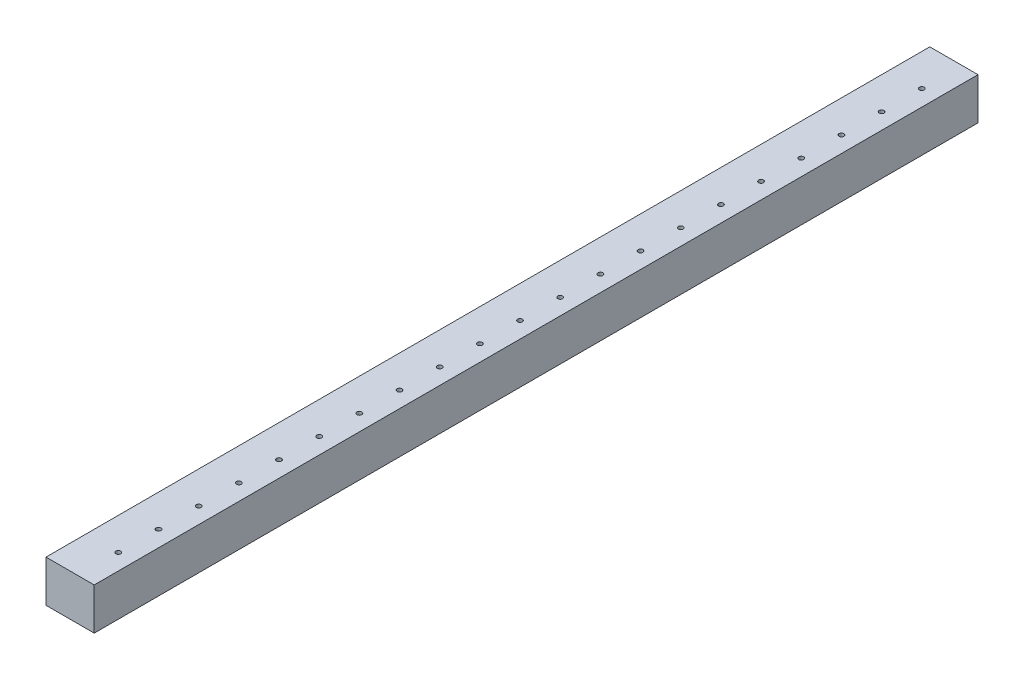
from build123d import *

# Parameters (mm, degrees)
ESQUISSE1_W                     = 30
ESQUISSE1_H                     = 36
BOSS_EXTRU_1_DEPTH              = 550
ENL_V_MAT_EXTRU_1_DEPTH         = 551.498864667
ENL_V_MAT_EXTRU_1_DEPTH_BACK    = 551.498864667
ESQUISSE2_W                     = 20
ESQUISSE2_H                     = 10
ESQUISSE3_R                     = 1.5
ENL_V_MAT_EXTRU_2_DEPTH         = 20
R_P_TITION_LIN_AIRE1_COUNT      = 11
R_P_TITION_LIN_AIRE1_PITCH      = 25
R_P_TITION_LIN_AIRE1_COUNT_DIR2 = 11
R_P_TITION_LIN_AIRE1_PITCH_DIR2 = 25
ENL_V_MAT_EXTRU_3_DEPTH         = 551.498864667
ENL_V_MAT_EXTRU_3_DEPTH_BACK    = 551.498864667
ESQUISSE4_W                     = 10
ESQUISSE4_H                     = 10


with BuildPart() as part:
    # Esquisse1 → Boss.-Extru.1 (new body)
    with BuildSketch(Plane.XY):
        Rectangle(ESQUISSE1_W, ESQUISSE1_H)
    extrude(amount=BOSS_EXTRU_1_DEPTH)

    # Esquisse2 → Enlèv. mat.-Extru.1 (cut, two sides: drawn at the far end of the back side and taken through both)
    with BuildSketch(Plane.XY.offset(550).offset(-ENL_V_MAT_EXTRU_1_DEPTH_BACK)):
        with Locations((5, 13)):
            Rectangle(ESQUISSE2_W, ESQUISSE2_H)
    extrude(amount=ENL_V_MAT_EXTRU_1_DEPTH + ENL_V_MAT_EXTRU_1_DEPTH_BACK, mode=Mode.SUBTRACT)

    # Esquisse3 → Enlèv. mat.-Extru.2 (cut)
    with BuildSketch(Plane(origin=(0, 8, 0), x_dir=(1, 0, 0), z_dir=(0, 1, 0))):
        with Locations((5, -275)):
            Circle(ESQUISSE3_R)
    enl_v_mat_extru_2 = extrude(amount=-ENL_V_MAT_EXTRU_2_DEPTH, mode=Mode.SUBTRACT)

    # Répétition linéaire1: Enl_v. mat.-Extru.2 11 × 11
    with Locations(*[Vector(0, 0, -1) * (i * R_P_TITION_LIN_AIRE1_PITCH) + Vector(0, 0, 1) * (j * R_P_TITION_LIN_AIRE1_PITCH_DIR2) for i in range(R_P_TITION_LIN_AIRE1_COUNT) for j in range(R_P_TITION_LIN_AIRE1_COUNT_DIR2) if (i, j) != (0, 0)]):
        add(enl_v_mat_extru_2, mode=Mode.SUBTRACT)

    # Esquisse4 → Enlèv. mat.-Extru.3 (cut, two sides: drawn at the far end of the back side and taken through both)
    with BuildSketch(Plane.XY.offset(550).offset(-ENL_V_MAT_EXTRU_3_DEPTH_BACK)):
        with Locations((-10, 13)):
            Rectangle(ESQUISSE4_W, ESQUISSE4_H)
    extrude(amount=ENL_V_MAT_EXTRU_3_DEPTH + ENL_V_MAT_EXTRU_3_DEPTH_BACK, mode=Mode.SUBTRACT)


solid = part.part
